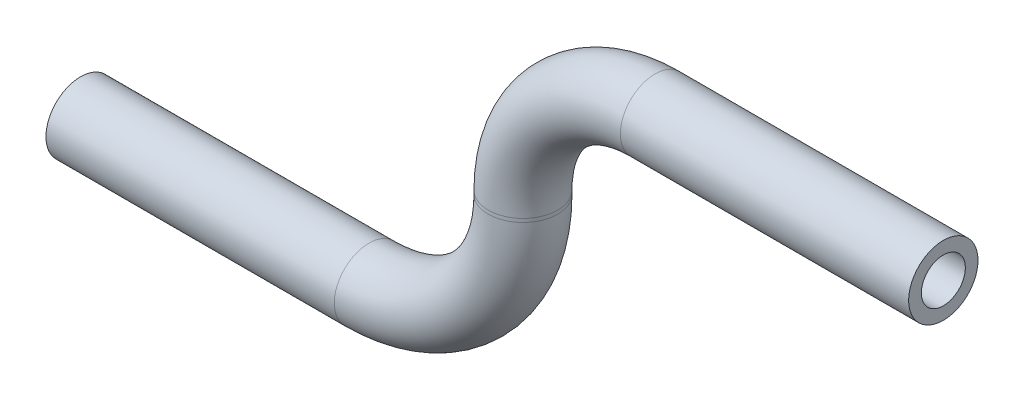
from build123d import *

# Parameters (mm, degrees)
SKETCH2_R   = 4
SKETCH2_R_2 = 2.54


with BuildPart() as part:
    # Sweep1: sweep along a path in Sketch1
    with BuildLine(Plane.XY) as sweep1_path:
        Line((0, 0), (33.274, 0))
        ThreePointArc((33.274, 0), (45.846358569, 5.207641431), (51.054, 17.78))
        Line((51.054, 17.78), (51.054, 18.1864))
        ThreePointArc((51.054, 18.1864), (55.517692655, 28.962707345), (66.294, 33.4264))
        Line((66.294, 33.4264), (99.568, 33.4264))
    # Sketch2 → Sweep1 (sweep)
    with BuildSketch(Plane(origin=(99.568, 33.4264, 0), x_dir=(0, 0, -1), z_dir=(1, 0, 0))):
        Circle(SKETCH2_R)
        Circle(SKETCH2_R_2, mode=Mode.SUBTRACT)
    sweep(path=sweep1_path.line)


solid = part.part
